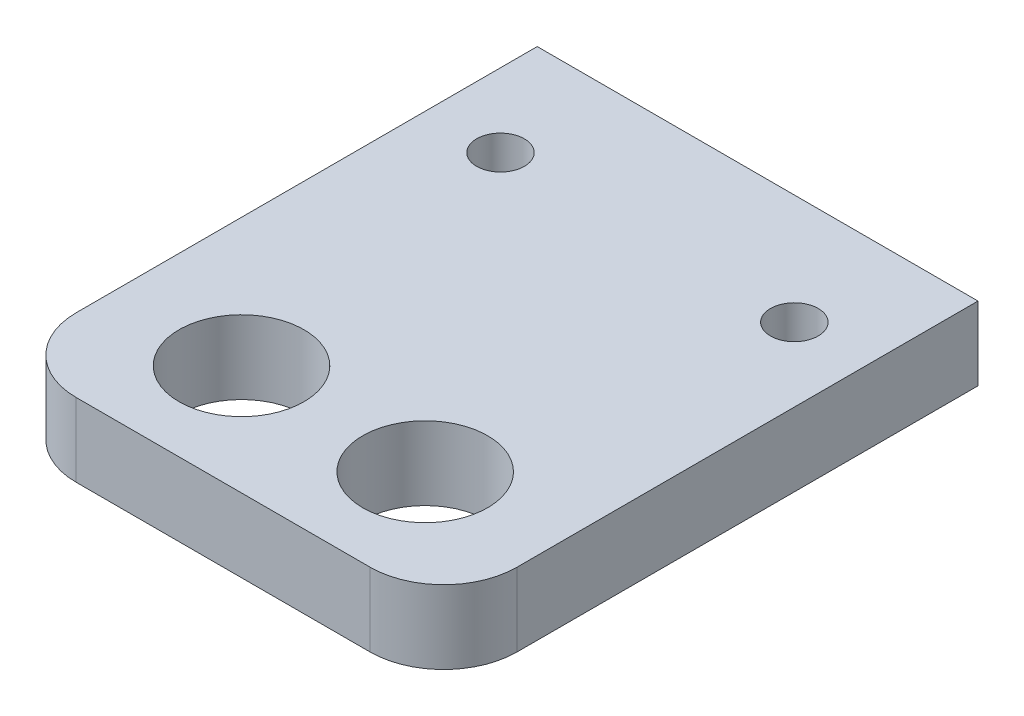
from build123d import *

# Parameters (mm, degrees)
SKETCH10_W          = 60
SKETCH10_H          = 72.75
SKETCH10_R          = 8.5
SKETCH10_R_2        = 3.25
BOSS_EXTRUDE1_DEPTH = 10
FILLET1_R           = 10


with BuildPart() as part:
    # Sketch10 → Boss-Extrude1 (new body)
    with BuildSketch(Plane(origin=(0, 0, 0), x_dir=(1, 0, 0), z_dir=(0, 1, 0))):
        with Locations((30, 36.375)):
            Rectangle(SKETCH10_W, SKETCH10_H)
        with Locations((17.5, 15)):
            Circle(SKETCH10_R, mode=Mode.SUBTRACT)
        with Locations((42.5, 15)):
            Circle(SKETCH10_R, mode=Mode.SUBTRACT)
        with Locations((10, 57.75)):
            Circle(SKETCH10_R_2, mode=Mode.SUBTRACT)
        with Locations((50, 57.75)):
            Circle(SKETCH10_R_2, mode=Mode.SUBTRACT)
    extrude(amount=BOSS_EXTRUDE1_DEPTH)

    # Fillet1
    fillet1_edges = [part.edges().sort_by_distance(p)[0] for p in [
        (60, 5, 0),
        (0, 5, 0),
    ]]
    fillet(fillet1_edges, radius=FILLET1_R)


solid = part.part
